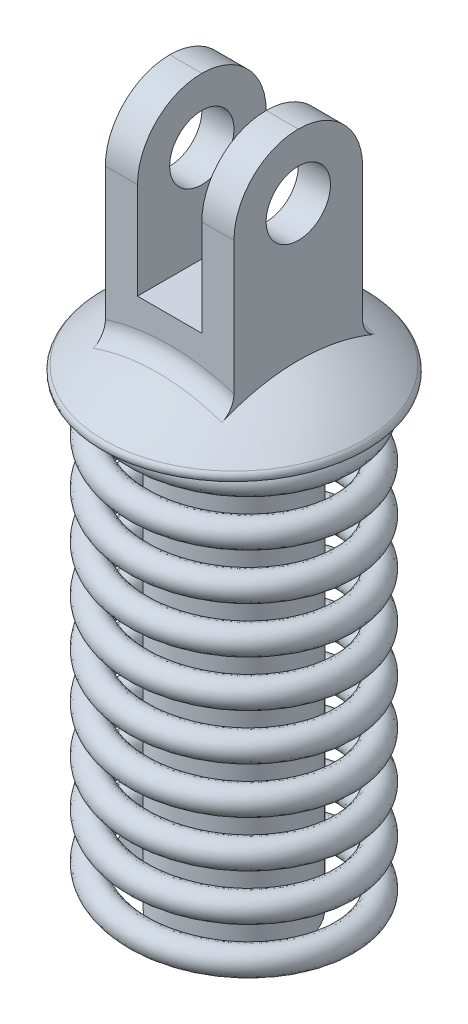
from build123d import *

# Parameters (mm, degrees)
SKETCH3_R                = 2.5
BOSS_EXTRUDE1_DEPTH      = 18
SWEEP1_PITCH             = 1.8
SWEEP1_HEIGHT            = 18
SWEEP1_RADIUS            = 4
SWEEP1_START_ANGLE       = -90
SKETCH6_R                = 0.5
BOSS_EXTRUDE2_REACH      = 34.781
BOSS_EXTRUDE2_END_RADIUS = 8
SKETCH7_W                = 5
SKETCH7_H                = 5
SKETCH8_W                = 1.25
SKETCH8_H                = 3.962571706
SKETCH8_W_2              = 2.5
SKETCH8_H_2              = 2.5
SKETCH8_H_3              = 3.75
CUT_EXTRUDE2_DEPTH       = 18
FILLET1_R                = 2.5
SKETCH9_R                = 1.25
CUT_EXTRUDE3_DEPTH       = 18
FILLET2_R                = 0.75


with BuildPart() as part:
    # Sketch2 → Revolve1 (revolve)
    with BuildSketch(Plane(origin=(0, 0, 0), x_dir=(0, 0, -1), z_dir=(1, 0, 0))):
        with BuildLine():
            Line((0, 3.645987547), (0, 1.537428294))
            Line((0, 1.537428294), (-5.12, 1.537428294))
            ThreePointArc((-5.12, 1.537428294), (-5.142617781, 1.703017441), (-5.0558511, 1.845856066))
            ThreePointArc((-5.0558511, 1.845856066), (-2.683379571, 3.182530128), (0, 3.645987547))
        make_face()
    revolve(axis=Axis((0, 8.279771429, 0), (0, -1, 0)))

    # Sketch3 → Boss-Extrude1 (add)
    with BuildSketch(Plane.XZ.offset(-1.537428294)):
        with Locations(Location((0, 0, 0), (0, 0, 270))):
            Circle(SKETCH3_R)
    extrude(amount=BOSS_EXTRUDE1_DEPTH)

    # Sweep1: sweep along a helix
    with BuildLine() as sweep1_path:
        add(Helix(SWEEP1_PITCH, SWEEP1_HEIGHT, SWEEP1_RADIUS, center=(0, 1.537428294, 0), direction=(0, -1, 0), lefthand=True, mode=Mode.PRIVATE).rotate(Axis((0, 1.537428294, 0), (0, -1, 0)), SWEEP1_START_ANGLE))
    # Sketch6 → Sweep1 (sweep)
    with BuildSketch(Plane.XY):
        with Locations((-4, 1.537428294)):
            Circle(SKETCH6_R)
    sweep(path=sweep1_path.line, is_frenet=True)

    # Boss-Extrude2: up to this sphere (the profile starts outside it)
    boss_extrude2_end = Location((0, -4.354012453, 0)) * Sphere(BOSS_EXTRUDE2_END_RADIUS, mode=Mode.PRIVATE)
    # Sketch7 → Boss-Extrude2 (add, up to the surface)
    with BuildSketch(Plane(origin=(0, 15, 0), x_dir=(1, 0, 0), z_dir=(0, 1, 0)), mode=Mode.PRIVATE) as boss_extrude2_sk1:
        Rectangle(SKETCH7_W, SKETCH7_H)
    boss_extrude2_tool1 = extrude(boss_extrude2_sk1.sketch, amount=-BOSS_EXTRUDE2_REACH, mode=Mode.PRIVATE) - boss_extrude2_end
    add(boss_extrude2_tool1.solids().sort_by_distance((0, 15, 0))[0])

    # Sketch8 → Cut-Extrude2 (cut)
    with BuildSketch(Plane.XY.offset(2.5)):
        with Locations((-1.875, 13.018714147)):
            Rectangle(SKETCH8_W, SKETCH8_H)
        with Locations((0, 13.018714147)):
            Rectangle(SKETCH8_W_2, SKETCH8_H)
        with Locations((1.875, 13.018714147)):
            Rectangle(SKETCH8_W, SKETCH8_H)
        with Locations((0, 9.787428294)):
            Rectangle(SKETCH8_W_2, SKETCH8_H_2)
        with Locations((0, 6.662428294)):
            Rectangle(SKETCH8_W_2, SKETCH8_H_3)
    extrude(amount=-CUT_EXTRUDE2_DEPTH, mode=Mode.SUBTRACT)

    # Fillet1
    fillet1_edges = [part.edges().sort_by_distance(p)[0] for p in [
        (-1.875, 11.037428294, 2.5),
        (-1.875, 11.037428294, -2.5),
        (1.875, 11.037428294, -2.5),
        (1.875, 11.037428294, 2.5),
    ]]
    fillet(fillet1_edges, radius=FILLET1_R - 0.0001)  # a hair under: the kernel refuses the full size

    # Sketch9 → Cut-Extrude3 (cut)
    with BuildSketch(Plane.ZY.offset(2.5)):
        with Locations((0, 8.537428294)):
            Circle(SKETCH9_R)
    extrude(amount=-CUT_EXTRUDE3_DEPTH, mode=Mode.SUBTRACT)

    # Fillet2
    fillet2_edges = [part.edges().sort_by_distance(p)[0] for p in [
        (0, 3.245329624, -2.5),
        (1.267765974, 3.138835433, 2.5),
    ]]
    fillet(fillet2_edges, radius=FILLET2_R)


solid = part.part
